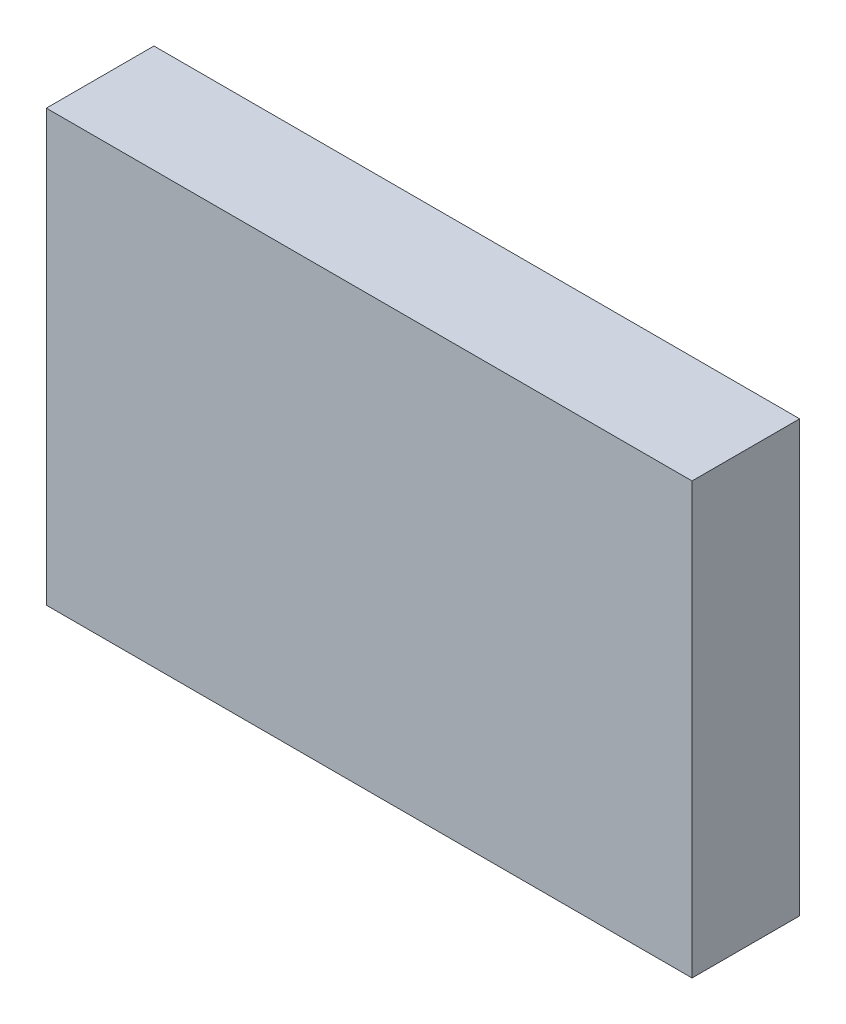
from build123d import *

# Parameters (mm, degrees)
SKETCH3_W           = 30
SKETCH3_H           = 20
BOSS_EXTRUDE1_DEPTH = 5


with BuildPart() as part:
    # Sketch3 → Boss-Extrude1 (new body)
    with BuildSketch(Plane.XY.offset(20)):
        Rectangle(SKETCH3_W, SKETCH3_H)
    extrude(amount=BOSS_EXTRUDE1_DEPTH)


solid = part.part
